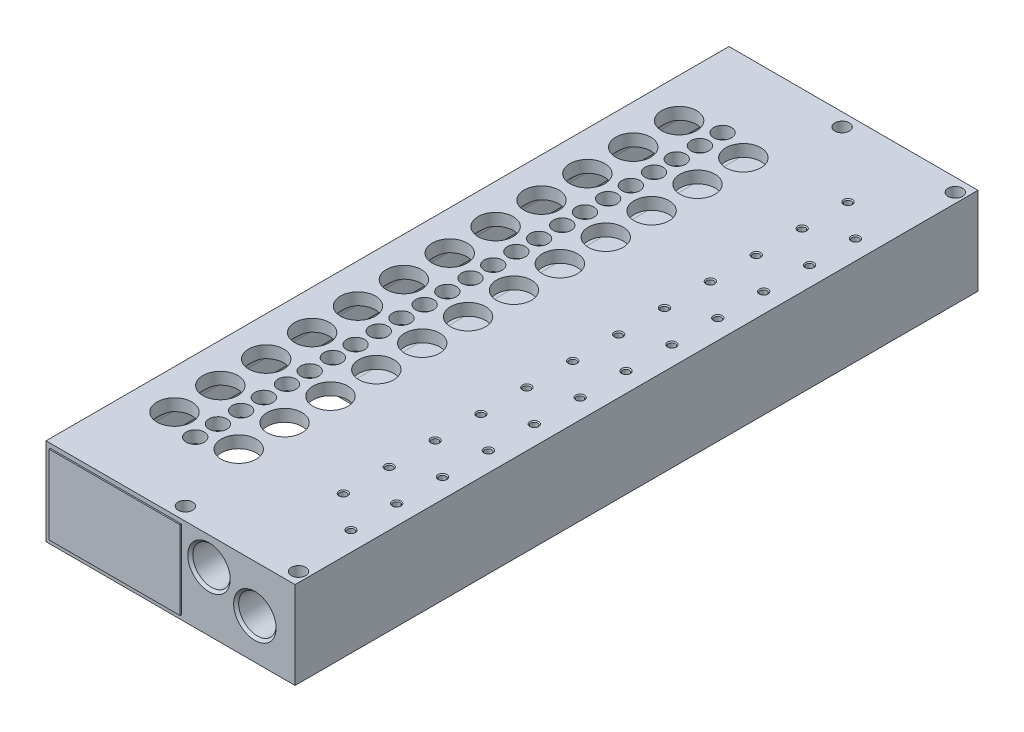
from build123d import *

# Parameters (mm, degrees)
SKETCH1_W           = 57
SKETCH1_H           = 20
BOSS_EXTRUDE1_DEPTH = 156.3
SKETCH2_R           = 4
CUT_EXTRUDE1_DEPTH  = 3
SKETCH3_R           = 4
CUT_EXTRUDE2_DEPTH  = 3
SKETCH4_R           = 4
CUT_EXTRUDE3_DEPTH  = 3
SKETCH5_R           = 4
CUT_EXTRUDE4_DEPTH  = 3
SKETCH6_R           = 4
CUT_EXTRUDE5_DEPTH  = 3
SKETCH7_R           = 4
CUT_EXTRUDE6_DEPTH  = 3
SKETCH8_R           = 4
CUT_EXTRUDE7_DEPTH  = 3
SKETCH9_R           = 4
CUT_EXTRUDE8_DEPTH  = 3
SKETCH10_R          = 4
CUT_EXTRUDE9_DEPTH  = 3
SKETCH11_R          = 4
CUT_EXTRUDE10_DEPTH = 3
SKETCH12_R          = 4
CUT_EXTRUDE11_DEPTH = 3
SKETCH13_R          = 4
CUT_EXTRUDE12_DEPTH = 3
SKETCH14_R          = 4
CUT_EXTRUDE13_DEPTH = 3
SKETCH15_R          = 4
CUT_EXTRUDE14_DEPTH = 3
SKETCH16_R          = 4
CUT_EXTRUDE15_DEPTH = 3
SKETCH17_R          = 4
CUT_EXTRUDE16_DEPTH = 3
SKETCH18_R          = 4
CUT_EXTRUDE17_DEPTH = 3
SKETCH19_R          = 4
CUT_EXTRUDE18_DEPTH = 3
SKETCH20_R          = 4
CUT_EXTRUDE19_DEPTH = 3
SKETCH21_R          = 4
CUT_EXTRUDE20_DEPTH = 3
SKETCH22_R          = 4
CUT_EXTRUDE21_DEPTH = 3
SKETCH23_R          = 4
CUT_EXTRUDE22_DEPTH = 3
SKETCH24_R          = 4
CUT_EXTRUDE23_DEPTH = 3
SKETCH25_R          = 4
CUT_EXTRUDE24_DEPTH = 3
SKETCH26_R          = 2.05
CUT_EXTRUDE25_DEPTH = 3
SKETCH27_R          = 2.05
CUT_EXTRUDE26_DEPTH = 3
SKETCH28_R          = 2.05
CUT_EXTRUDE27_DEPTH = 3
SKETCH29_R          = 2.05
CUT_EXTRUDE28_DEPTH = 3
SKETCH30_R          = 2.05
CUT_EXTRUDE29_DEPTH = 3
SKETCH31_R          = 2.05
CUT_EXTRUDE30_DEPTH = 3
SKETCH32_R          = 2.05
CUT_EXTRUDE31_DEPTH = 3
SKETCH33_R          = 2.05
CUT_EXTRUDE32_DEPTH = 3
SKETCH34_R          = 2.05
CUT_EXTRUDE33_DEPTH = 3
SKETCH35_R          = 2.05
CUT_EXTRUDE34_DEPTH = 3
SKETCH36_R          = 2.05
CUT_EXTRUDE35_DEPTH = 3
SKETCH37_R          = 2.05
CUT_EXTRUDE36_DEPTH = 3
SKETCH38_R          = 2.05
CUT_EXTRUDE37_DEPTH = 3
SKETCH39_R          = 2.05
CUT_EXTRUDE38_DEPTH = 3
SKETCH40_R          = 2.05
CUT_EXTRUDE39_DEPTH = 3
SKETCH41_R          = 2.05
CUT_EXTRUDE40_DEPTH = 3
SKETCH42_R          = 2.05
CUT_EXTRUDE41_DEPTH = 3
SKETCH43_R          = 2.05
CUT_EXTRUDE42_DEPTH = 3
SKETCH44_R          = 2.05
CUT_EXTRUDE43_DEPTH = 3
SKETCH45_R          = 2.05
CUT_EXTRUDE44_DEPTH = 3
SKETCH46_R          = 2.05
CUT_EXTRUDE45_DEPTH = 3
SKETCH47_R          = 2.05
CUT_EXTRUDE46_DEPTH = 3
SKETCH48_R          = 2.05
CUT_EXTRUDE47_DEPTH = 3
SKETCH49_R          = 2.05
CUT_EXTRUDE48_DEPTH = 3
SKETCH78_W          = 1.65
SKETCH78_H          = 20
SKETCH79_W          = 1.65
SKETCH79_H          = 20
SKETCH80_W          = 1.65
SKETCH80_H          = 20
SKETCH81_W          = 1.65
SKETCH81_H          = 20
CUT_EXTRUDE49_DEPTH = 1.4
CUT_EXTRUDE50_DEPTH = 2.9
SKETCH108_W         = 30
SKETCH108_H         = 18
BOSS_EXTRUDE2_DEPTH = 0.3
SKETCH109_W         = 30
SKETCH109_H         = 18
BOSS_EXTRUDE3_DEPTH = 0.3


with BuildPart() as part:
    # Sketch1 → Boss-Extrude1 (new body)
    with BuildSketch(Plane.XY.offset(-135.9)):
        with Locations((28.5, 10)):
            Rectangle(SKETCH1_W, SKETCH1_H)
        with BuildLine():
            Line((46.9, 7.100431067), (46.9, 8.5))
            ThreePointArc((46.9, 8.5), (47.046446609, 8.853553391), (47.4, 9))
            Line((47.4, 9), (47.85, 9))
            ThreePointArc((47.85, 9), (48.203553391, 9.146446609), (48.35, 9.5))
            Line((48.35, 9.5), (48.35, 11.396424004))
            ThreePointArc((48.35, 11.396424004), (47.872077716, 12.494311586), (46.742857143, 12.89259258))
            ThreePointArc((46.742857143, 12.89259258), (44.051066685, 9.921351181), (46.9, 7.100431067))
        make_face(mode=Mode.SUBTRACT)
        with BuildLine():
            Line((38.7, 10.80910977), (38.7, 15.19089023))
            ThreePointArc((38.7, 15.19089023), (33.9, 13), (38.7, 10.80910977))
        make_face(mode=Mode.SUBTRACT)
        with BuildLine():
            Line((2.5, 11.35), (2.5, 9.25))
            Line((2.5, 9.25), (4, 9.25))
            Line((4, 9.25), (4, 4.75))
            ThreePointArc((4, 4.75), (4.585786438, 3.335786438), (6, 2.75))
            Line((6, 2.75), (26.7, 2.75))
            ThreePointArc((26.7, 2.75), (28.114213562, 3.335786438), (28.7, 4.75))
            Line((28.7, 4.75), (28.7, 9.25))
            Line((28.7, 9.25), (30.2, 9.25))
            Line((30.2, 9.25), (30.2, 11.35))
            Line((30.2, 11.35), (28.7, 11.35))
            Line((28.7, 11.35), (28.7, 15.25))
            ThreePointArc((28.7, 15.25), (28.114213562, 16.664213562), (26.7, 17.25))
            Line((26.7, 17.25), (6, 17.25))
            ThreePointArc((6, 17.25), (4.585786438, 16.664213562), (4, 15.25))
            Line((4, 15.25), (4, 11.35))
            Line((4, 11.35), (2.5, 11.35))
        make_face(mode=Mode.SUBTRACT)
    extrude(amount=BOSS_EXTRUDE1_DEPTH)

    # Sketch2 → Cut-Extrude1 (cut)
    with BuildSketch(Plane(origin=(0, 20, 0), x_dir=(1, 0, 0), z_dir=(0, 1, 0))):
        with Locations((9, 0)):
            Circle(SKETCH2_R)
    extrude(amount=-CUT_EXTRUDE1_DEPTH, mode=Mode.SUBTRACT)

    # Sketch3 → Cut-Extrude2 (cut)
    with BuildSketch(Plane(origin=(0, 20, 0), x_dir=(1, 0, 0), z_dir=(0, 1, 0))):
        with Locations((9, 10.5)):
            Circle(SKETCH3_R)
    extrude(amount=-CUT_EXTRUDE2_DEPTH, mode=Mode.SUBTRACT)

    # Sketch4 → Cut-Extrude3 (cut)
    with BuildSketch(Plane(origin=(0, 20, 0), x_dir=(1, 0, 0), z_dir=(0, 1, 0))):
        with Locations((9, 21)):
            Circle(SKETCH4_R)
    extrude(amount=-CUT_EXTRUDE3_DEPTH, mode=Mode.SUBTRACT)

    # Sketch5 → Cut-Extrude4 (cut)
    with BuildSketch(Plane(origin=(0, 20, 0), x_dir=(1, 0, 0), z_dir=(0, 1, 0))):
        with Locations((9, 31.5)):
            Circle(SKETCH5_R)
    extrude(amount=-CUT_EXTRUDE4_DEPTH, mode=Mode.SUBTRACT)

    # Sketch6 → Cut-Extrude5 (cut)
    with BuildSketch(Plane(origin=(0, 20, 0), x_dir=(1, 0, 0), z_dir=(0, 1, 0))):
        with Locations((9, 42)):
            Circle(SKETCH6_R)
    extrude(amount=-CUT_EXTRUDE5_DEPTH, mode=Mode.SUBTRACT)

    # Sketch7 → Cut-Extrude6 (cut)
    with BuildSketch(Plane(origin=(0, 20, 0), x_dir=(1, 0, 0), z_dir=(0, 1, 0))):
        with Locations((9, 52.5)):
            Circle(SKETCH7_R)
    extrude(amount=-CUT_EXTRUDE6_DEPTH, mode=Mode.SUBTRACT)

    # Sketch8 → Cut-Extrude7 (cut)
    with BuildSketch(Plane(origin=(0, 20, 0), x_dir=(1, 0, 0), z_dir=(0, 1, 0))):
        with Locations((9, 63)):
            Circle(SKETCH8_R)
    extrude(amount=-CUT_EXTRUDE7_DEPTH, mode=Mode.SUBTRACT)

    # Sketch9 → Cut-Extrude8 (cut)
    with BuildSketch(Plane(origin=(0, 20, 0), x_dir=(1, 0, 0), z_dir=(0, 1, 0))):
        with Locations((9, 73.5)):
            Circle(SKETCH9_R)
    extrude(amount=-CUT_EXTRUDE8_DEPTH, mode=Mode.SUBTRACT)

    # Sketch10 → Cut-Extrude9 (cut)
    with BuildSketch(Plane(origin=(0, 20, 0), x_dir=(1, 0, 0), z_dir=(0, 1, 0))):
        with Locations((9, 84)):
            Circle(SKETCH10_R)
    extrude(amount=-CUT_EXTRUDE9_DEPTH, mode=Mode.SUBTRACT)

    # Sketch11 → Cut-Extrude10 (cut)
    with BuildSketch(Plane(origin=(0, 20, 0), x_dir=(1, 0, 0), z_dir=(0, 1, 0))):
        with Locations((9, 94.5)):
            Circle(SKETCH11_R)
    extrude(amount=-CUT_EXTRUDE10_DEPTH, mode=Mode.SUBTRACT)

    # Sketch12 → Cut-Extrude11 (cut)
    with BuildSketch(Plane(origin=(0, 20, 0), x_dir=(1, 0, 0), z_dir=(0, 1, 0))):
        with Locations((9, 105)):
            Circle(SKETCH12_R)
    extrude(amount=-CUT_EXTRUDE11_DEPTH, mode=Mode.SUBTRACT)

    # Sketch13 → Cut-Extrude12 (cut)
    with BuildSketch(Plane(origin=(0, 20, 0), x_dir=(1, 0, 0), z_dir=(0, 1, 0))):
        with Locations((9, 115.5)):
            Circle(SKETCH13_R)
    extrude(amount=-CUT_EXTRUDE12_DEPTH, mode=Mode.SUBTRACT)

    # Sketch14 → Cut-Extrude13 (cut)
    with BuildSketch(Plane(origin=(0, 20, 0), x_dir=(1, 0, 0), z_dir=(0, 1, 0))):
        with Locations((23.7, 0)):
            Circle(SKETCH14_R)
    extrude(amount=-CUT_EXTRUDE13_DEPTH, mode=Mode.SUBTRACT)

    # Sketch15 → Cut-Extrude14 (cut)
    with BuildSketch(Plane(origin=(0, 20, 0), x_dir=(1, 0, 0), z_dir=(0, 1, 0))):
        with Locations((23.7, 10.5)):
            Circle(SKETCH15_R)
    extrude(amount=-CUT_EXTRUDE14_DEPTH, mode=Mode.SUBTRACT)

    # Sketch16 → Cut-Extrude15 (cut)
    with BuildSketch(Plane(origin=(0, 20, 0), x_dir=(1, 0, 0), z_dir=(0, 1, 0))):
        with Locations((23.7, 21)):
            Circle(SKETCH16_R)
    extrude(amount=-CUT_EXTRUDE15_DEPTH, mode=Mode.SUBTRACT)

    # Sketch17 → Cut-Extrude16 (cut)
    with BuildSketch(Plane(origin=(0, 20, 0), x_dir=(1, 0, 0), z_dir=(0, 1, 0))):
        with Locations((23.7, 31.5)):
            Circle(SKETCH17_R)
    extrude(amount=-CUT_EXTRUDE16_DEPTH, mode=Mode.SUBTRACT)

    # Sketch18 → Cut-Extrude17 (cut)
    with BuildSketch(Plane(origin=(0, 20, 0), x_dir=(1, 0, 0), z_dir=(0, 1, 0))):
        with Locations((23.7, 42)):
            Circle(SKETCH18_R)
    extrude(amount=-CUT_EXTRUDE17_DEPTH, mode=Mode.SUBTRACT)

    # Sketch19 → Cut-Extrude18 (cut)
    with BuildSketch(Plane(origin=(0, 20, 0), x_dir=(1, 0, 0), z_dir=(0, 1, 0))):
        with Locations((23.7, 52.5)):
            Circle(SKETCH19_R)
    extrude(amount=-CUT_EXTRUDE18_DEPTH, mode=Mode.SUBTRACT)

    # Sketch20 → Cut-Extrude19 (cut)
    with BuildSketch(Plane(origin=(0, 20, 0), x_dir=(1, 0, 0), z_dir=(0, 1, 0))):
        with Locations((23.7, 63)):
            Circle(SKETCH20_R)
    extrude(amount=-CUT_EXTRUDE19_DEPTH, mode=Mode.SUBTRACT)

    # Sketch21 → Cut-Extrude20 (cut)
    with BuildSketch(Plane(origin=(0, 20, 0), x_dir=(1, 0, 0), z_dir=(0, 1, 0))):
        with Locations((23.7, 73.5)):
            Circle(SKETCH21_R)
    extrude(amount=-CUT_EXTRUDE20_DEPTH, mode=Mode.SUBTRACT)

    # Sketch22 → Cut-Extrude21 (cut)
    with BuildSketch(Plane(origin=(0, 20, 0), x_dir=(1, 0, 0), z_dir=(0, 1, 0))):
        with Locations((23.7, 84)):
            Circle(SKETCH22_R)
    extrude(amount=-CUT_EXTRUDE21_DEPTH, mode=Mode.SUBTRACT)

    # Sketch23 → Cut-Extrude22 (cut)
    with BuildSketch(Plane(origin=(0, 20, 0), x_dir=(1, 0, 0), z_dir=(0, 1, 0))):
        with Locations((23.7, 94.5)):
            Circle(SKETCH23_R)
    extrude(amount=-CUT_EXTRUDE22_DEPTH, mode=Mode.SUBTRACT)

    # Sketch24 → Cut-Extrude23 (cut)
    with BuildSketch(Plane(origin=(0, 20, 0), x_dir=(1, 0, 0), z_dir=(0, 1, 0))):
        with Locations((23.7, 105)):
            Circle(SKETCH24_R)
    extrude(amount=-CUT_EXTRUDE23_DEPTH, mode=Mode.SUBTRACT)

    # Sketch25 → Cut-Extrude24 (cut)
    with BuildSketch(Plane(origin=(0, 20, 0), x_dir=(1, 0, 0), z_dir=(0, 1, 0))):
        with Locations((23.7, 115.5)):
            Circle(SKETCH25_R)
    extrude(amount=-CUT_EXTRUDE24_DEPTH, mode=Mode.SUBTRACT)

    # Sketch26 → Cut-Extrude25 (cut)
    with BuildSketch(Plane(origin=(0, 20, 0), x_dir=(1, 0, 0), z_dir=(0, 1, 0))):
        with Locations((16.35, -2.6)):
            Circle(SKETCH26_R)
    extrude(amount=-CUT_EXTRUDE25_DEPTH, mode=Mode.SUBTRACT)

    # Sketch27 → Cut-Extrude26 (cut)
    with BuildSketch(Plane(origin=(0, 20, 0), x_dir=(1, 0, 0), z_dir=(0, 1, 0))):
        with Locations((16.35, 7.9)):
            Circle(SKETCH27_R)
    extrude(amount=-CUT_EXTRUDE26_DEPTH, mode=Mode.SUBTRACT)

    # Sketch28 → Cut-Extrude27 (cut)
    with BuildSketch(Plane(origin=(0, 20, 0), x_dir=(1, 0, 0), z_dir=(0, 1, 0))):
        with Locations((16.35, 18.4)):
            Circle(SKETCH28_R)
    extrude(amount=-CUT_EXTRUDE27_DEPTH, mode=Mode.SUBTRACT)

    # Sketch29 → Cut-Extrude28 (cut)
    with BuildSketch(Plane(origin=(0, 20, 0), x_dir=(1, 0, 0), z_dir=(0, 1, 0))):
        with Locations((16.35, 28.9)):
            Circle(SKETCH29_R)
    extrude(amount=-CUT_EXTRUDE28_DEPTH, mode=Mode.SUBTRACT)

    # Sketch30 → Cut-Extrude29 (cut)
    with BuildSketch(Plane(origin=(0, 20, 0), x_dir=(1, 0, 0), z_dir=(0, 1, 0))):
        with Locations((16.35, 39.4)):
            Circle(SKETCH30_R)
    extrude(amount=-CUT_EXTRUDE29_DEPTH, mode=Mode.SUBTRACT)

    # Sketch31 → Cut-Extrude30 (cut)
    with BuildSketch(Plane(origin=(0, 20, 0), x_dir=(1, 0, 0), z_dir=(0, 1, 0))):
        with Locations((16.35, 49.9)):
            Circle(SKETCH31_R)
    extrude(amount=-CUT_EXTRUDE30_DEPTH, mode=Mode.SUBTRACT)

    # Sketch32 → Cut-Extrude31 (cut)
    with BuildSketch(Plane(origin=(0, 20, 0), x_dir=(1, 0, 0), z_dir=(0, 1, 0))):
        with Locations((16.35, 60.4)):
            Circle(SKETCH32_R)
    extrude(amount=-CUT_EXTRUDE31_DEPTH, mode=Mode.SUBTRACT)

    # Sketch33 → Cut-Extrude32 (cut)
    with BuildSketch(Plane(origin=(0, 20, 0), x_dir=(1, 0, 0), z_dir=(0, 1, 0))):
        with Locations((16.35, 70.9)):
            Circle(SKETCH33_R)
    extrude(amount=-CUT_EXTRUDE32_DEPTH, mode=Mode.SUBTRACT)

    # Sketch34 → Cut-Extrude33 (cut)
    with BuildSketch(Plane(origin=(0, 20, 0), x_dir=(1, 0, 0), z_dir=(0, 1, 0))):
        with Locations((16.35, 81.4)):
            Circle(SKETCH34_R)
    extrude(amount=-CUT_EXTRUDE33_DEPTH, mode=Mode.SUBTRACT)

    # Sketch35 → Cut-Extrude34 (cut)
    with BuildSketch(Plane(origin=(0, 20, 0), x_dir=(1, 0, 0), z_dir=(0, 1, 0))):
        with Locations((16.35, 91.9)):
            Circle(SKETCH35_R)
    extrude(amount=-CUT_EXTRUDE34_DEPTH, mode=Mode.SUBTRACT)

    # Sketch36 → Cut-Extrude35 (cut)
    with BuildSketch(Plane(origin=(0, 20, 0), x_dir=(1, 0, 0), z_dir=(0, 1, 0))):
        with Locations((16.35, 102.4)):
            Circle(SKETCH36_R)
    extrude(amount=-CUT_EXTRUDE35_DEPTH, mode=Mode.SUBTRACT)

    # Sketch37 → Cut-Extrude36 (cut)
    with BuildSketch(Plane(origin=(0, 20, 0), x_dir=(1, 0, 0), z_dir=(0, 1, 0))):
        with Locations((16.35, 112.9)):
            Circle(SKETCH37_R)
    extrude(amount=-CUT_EXTRUDE36_DEPTH, mode=Mode.SUBTRACT)

    # Sketch38 → Cut-Extrude37 (cut)
    with BuildSketch(Plane(origin=(0, 20, 0), x_dir=(1, 0, 0), z_dir=(0, 1, 0))):
        with Locations((16.35, 2.6)):
            Circle(SKETCH38_R)
    extrude(amount=-CUT_EXTRUDE37_DEPTH, mode=Mode.SUBTRACT)

    # Sketch39 → Cut-Extrude38 (cut)
    with BuildSketch(Plane(origin=(0, 20, 0), x_dir=(1, 0, 0), z_dir=(0, 1, 0))):
        with Locations((16.35, 13.1)):
            Circle(SKETCH39_R)
    extrude(amount=-CUT_EXTRUDE38_DEPTH, mode=Mode.SUBTRACT)

    # Sketch40 → Cut-Extrude39 (cut)
    with BuildSketch(Plane(origin=(0, 20, 0), x_dir=(1, 0, 0), z_dir=(0, 1, 0))):
        with Locations((16.35, 23.6)):
            Circle(SKETCH40_R)
    extrude(amount=-CUT_EXTRUDE39_DEPTH, mode=Mode.SUBTRACT)

    # Sketch41 → Cut-Extrude40 (cut)
    with BuildSketch(Plane(origin=(0, 20, 0), x_dir=(1, 0, 0), z_dir=(0, 1, 0))):
        with Locations((16.35, 34.1)):
            Circle(SKETCH41_R)
    extrude(amount=-CUT_EXTRUDE40_DEPTH, mode=Mode.SUBTRACT)

    # Sketch42 → Cut-Extrude41 (cut)
    with BuildSketch(Plane(origin=(0, 20, 0), x_dir=(1, 0, 0), z_dir=(0, 1, 0))):
        with Locations((16.35, 44.6)):
            Circle(SKETCH42_R)
    extrude(amount=-CUT_EXTRUDE41_DEPTH, mode=Mode.SUBTRACT)

    # Sketch43 → Cut-Extrude42 (cut)
    with BuildSketch(Plane(origin=(0, 20, 0), x_dir=(1, 0, 0), z_dir=(0, 1, 0))):
        with Locations((16.35, 55.1)):
            Circle(SKETCH43_R)
    extrude(amount=-CUT_EXTRUDE42_DEPTH, mode=Mode.SUBTRACT)

    # Sketch44 → Cut-Extrude43 (cut)
    with BuildSketch(Plane(origin=(0, 20, 0), x_dir=(1, 0, 0), z_dir=(0, 1, 0))):
        with Locations((16.35, 65.6)):
            Circle(SKETCH44_R)
    extrude(amount=-CUT_EXTRUDE43_DEPTH, mode=Mode.SUBTRACT)

    # Sketch45 → Cut-Extrude44 (cut)
    with BuildSketch(Plane(origin=(0, 20, 0), x_dir=(1, 0, 0), z_dir=(0, 1, 0))):
        with Locations((16.35, 76.1)):
            Circle(SKETCH45_R)
    extrude(amount=-CUT_EXTRUDE44_DEPTH, mode=Mode.SUBTRACT)

    # Sketch46 → Cut-Extrude45 (cut)
    with BuildSketch(Plane(origin=(0, 20, 0), x_dir=(1, 0, 0), z_dir=(0, 1, 0))):
        with Locations((16.35, 86.6)):
            Circle(SKETCH46_R)
    extrude(amount=-CUT_EXTRUDE45_DEPTH, mode=Mode.SUBTRACT)

    # Sketch47 → Cut-Extrude46 (cut)
    with BuildSketch(Plane(origin=(0, 20, 0), x_dir=(1, 0, 0), z_dir=(0, 1, 0))):
        with Locations((16.35, 97.1)):
            Circle(SKETCH47_R)
    extrude(amount=-CUT_EXTRUDE46_DEPTH, mode=Mode.SUBTRACT)

    # Sketch48 → Cut-Extrude47 (cut)
    with BuildSketch(Plane(origin=(0, 20, 0), x_dir=(1, 0, 0), z_dir=(0, 1, 0))):
        with Locations((16.35, 107.6)):
            Circle(SKETCH48_R)
    extrude(amount=-CUT_EXTRUDE47_DEPTH, mode=Mode.SUBTRACT)

    # Sketch49 → Cut-Extrude48 (cut)
    with BuildSketch(Plane(origin=(0, 20, 0), x_dir=(1, 0, 0), z_dir=(0, 1, 0))):
        with Locations((16.35, 118.1)):
            Circle(SKETCH49_R)
    extrude(amount=-CUT_EXTRUDE48_DEPTH, mode=Mode.SUBTRACT)

    # Sketch50 → Cut-Revolve1 (revolve, cut)
    with BuildSketch(Plane(origin=(44.45, 0, 0), x_dir=(0, 0, -1), z_dir=(1, 0, 0))):
        Polygon((3.2, 20), (4.2, 20), (3.9835, 19.7835), (3.9835, 14.452353936), (3.2, 14), align=None)
    revolve(axis=Axis((44.45, 14, -3.2), (0, 1, 0)), mode=Mode.SUBTRACT)

    # Sketch51 → Cut-Revolve2 (revolve, cut)
    with BuildSketch(Plane(origin=(44.45, 0, 0), x_dir=(0, 0, -1), z_dir=(1, 0, 0))):
        Polygon((13.7, 20), (14.7, 20), (14.4835, 19.7835), (14.4835, 14.452353936), (13.7, 14), align=None)
    revolve(axis=Axis((44.45, 14, -13.7), (0, 1, 0)), mode=Mode.SUBTRACT)

    # Sketch52 → Cut-Revolve3 (revolve, cut)
    with BuildSketch(Plane(origin=(44.45, 0, 0), x_dir=(0, 0, -1), z_dir=(1, 0, 0))):
        Polygon((24.2, 20), (25.2, 20), (24.9835, 19.7835), (24.9835, 14.452353936), (24.2, 14), align=None)
    revolve(axis=Axis((44.45, 14, -24.2), (0, 1, 0)), mode=Mode.SUBTRACT)

    # Sketch53 → Cut-Revolve4 (revolve, cut)
    with BuildSketch(Plane(origin=(44.45, 0, 0), x_dir=(0, 0, -1), z_dir=(1, 0, 0))):
        Polygon((34.7, 20), (35.7, 20), (35.4835, 19.7835), (35.4835, 14.452353936), (34.7, 14), align=None)
    revolve(axis=Axis((44.45, 14, -34.7), (0, 1, 0)), mode=Mode.SUBTRACT)

    # Sketch54 → Cut-Revolve5 (revolve, cut)
    with BuildSketch(Plane(origin=(44.45, 0, 0), x_dir=(0, 0, -1), z_dir=(1, 0, 0))):
        Polygon((45.2, 20), (46.2, 20), (45.9835, 19.7835), (45.9835, 14.452353936), (45.2, 14), align=None)
    revolve(axis=Axis((44.45, 14, -45.2), (0, 1, 0)), mode=Mode.SUBTRACT)

    # Sketch55 → Cut-Revolve6 (revolve, cut)
    with BuildSketch(Plane(origin=(44.45, 0, 0), x_dir=(0, 0, -1), z_dir=(1, 0, 0))):
        Polygon((55.7, 20), (56.7, 20), (56.4835, 19.7835), (56.4835, 14.452353936), (55.7, 14), align=None)
    revolve(axis=Axis((44.45, 14, -55.7), (0, 1, 0)), mode=Mode.SUBTRACT)

    # Sketch56 → Cut-Revolve7 (revolve, cut)
    with BuildSketch(Plane(origin=(44.45, 0, 0), x_dir=(0, 0, -1), z_dir=(1, 0, 0))):
        Polygon((66.2, 20), (67.2, 20), (66.9835, 19.7835), (66.9835, 14.452353936), (66.2, 14), align=None)
    revolve(axis=Axis((44.45, 14, -66.2), (0, 1, 0)), mode=Mode.SUBTRACT)

    # Sketch57 → Cut-Revolve8 (revolve, cut)
    with BuildSketch(Plane(origin=(44.45, 0, 0), x_dir=(0, 0, -1), z_dir=(1, 0, 0))):
        Polygon((76.7, 20), (77.7, 20), (77.4835, 19.7835), (77.4835, 14.452353936), (76.7, 14), align=None)
    revolve(axis=Axis((44.45, 14, -76.7), (0, 1, 0)), mode=Mode.SUBTRACT)

    # Sketch58 → Cut-Revolve9 (revolve, cut)
    with BuildSketch(Plane(origin=(44.45, 0, 0), x_dir=(0, 0, -1), z_dir=(1, 0, 0))):
        Polygon((87.2, 20), (88.2, 20), (87.9835, 19.7835), (87.9835, 14.452353936), (87.2, 14), align=None)
    revolve(axis=Axis((44.45, 14, -87.2), (0, 1, 0)), mode=Mode.SUBTRACT)

    # Sketch59 → Cut-Revolve10 (revolve, cut)
    with BuildSketch(Plane(origin=(44.45, 0, 0), x_dir=(0, 0, -1), z_dir=(1, 0, 0))):
        Polygon((97.7, 20), (98.7, 20), (98.4835, 19.7835), (98.4835, 14.452353936), (97.7, 14), align=None)
    revolve(axis=Axis((44.45, 14, -97.7), (0, 1, 0)), mode=Mode.SUBTRACT)

    # Sketch60 → Cut-Revolve11 (revolve, cut)
    with BuildSketch(Plane(origin=(44.45, 0, 0), x_dir=(0, 0, -1), z_dir=(1, 0, 0))):
        Polygon((108.2, 20), (109.2, 20), (108.9835, 19.7835), (108.9835, 14.452353936), (108.2, 14), align=None)
    revolve(axis=Axis((44.45, 14, -108.2), (0, 1, 0)), mode=Mode.SUBTRACT)

    # Sketch61 → Cut-Revolve12 (revolve, cut)
    with BuildSketch(Plane(origin=(44.45, 0, 0), x_dir=(0, 0, -1), z_dir=(1, 0, 0))):
        Polygon((118.7, 20), (119.7, 20), (119.4835, 19.7835), (119.4835, 14.452353936), (118.7, 14), align=None)
    revolve(axis=Axis((44.45, 14, -118.7), (0, 1, 0)), mode=Mode.SUBTRACT)

    # Sketch62 → Cut-Revolve13 (revolve, cut)
    with BuildSketch(Plane(origin=(52.6, 0, 0), x_dir=(0, 0, -1), z_dir=(1, 0, 0))):
        Polygon((-3.2, 20), (-2.2, 20), (-2.4165, 19.7835), (-2.4165, 14.452353936), (-3.2, 14), align=None)
    revolve(axis=Axis((52.6, 14, 3.2), (0, 1, 0)), mode=Mode.SUBTRACT)

    # Sketch63 → Cut-Revolve14 (revolve, cut)
    with BuildSketch(Plane(origin=(52.55, 0, 0), x_dir=(0, 0, -1), z_dir=(1, 0, 0))):
        Polygon((7.3, 20), (8.3, 20), (8.0835, 19.7835), (8.0835, 14.452353936), (7.3, 14), align=None)
    revolve(axis=Axis((52.55, 14, -7.3), (0, 1, 0)), mode=Mode.SUBTRACT)

    # Sketch64 → Cut-Revolve15 (revolve, cut)
    with BuildSketch(Plane(origin=(52.55, 0, 0), x_dir=(0, 0, -1), z_dir=(1, 0, 0))):
        Polygon((17.8, 20), (18.8, 20), (18.5835, 19.7835), (18.5835, 14.452353936), (17.8, 14), align=None)
    revolve(axis=Axis((52.55, 14, -17.8), (0, 1, 0)), mode=Mode.SUBTRACT)

    # Sketch65 → Cut-Revolve16 (revolve, cut)
    with BuildSketch(Plane(origin=(52.55, 0, 0), x_dir=(0, 0, -1), z_dir=(1, 0, 0))):
        Polygon((28.3, 20), (29.3, 20), (29.0835, 19.7835), (29.0835, 14.452353936), (28.3, 14), align=None)
    revolve(axis=Axis((52.55, 14, -28.3), (0, 1, 0)), mode=Mode.SUBTRACT)

    # Sketch66 → Cut-Revolve17 (revolve, cut)
    with BuildSketch(Plane(origin=(52.55, 0, 0), x_dir=(0, 0, -1), z_dir=(1, 0, 0))):
        Polygon((38.8, 20), (39.8, 20), (39.5835, 19.7835), (39.5835, 14.452353936), (38.8, 14), align=None)
    revolve(axis=Axis((52.55, 14, -38.8), (0, 1, 0)), mode=Mode.SUBTRACT)

    # Sketch67 → Cut-Revolve18 (revolve, cut)
    with BuildSketch(Plane(origin=(52.55, 0, 0), x_dir=(0, 0, -1), z_dir=(1, 0, 0))):
        Polygon((49.3, 20), (50.3, 20), (50.0835, 19.7835), (50.0835, 14.452353936), (49.3, 14), align=None)
    revolve(axis=Axis((52.55, 14, -49.3), (0, 1, 0)), mode=Mode.SUBTRACT)

    # Sketch68 → Cut-Revolve19 (revolve, cut)
    with BuildSketch(Plane(origin=(52.55, 0, 0), x_dir=(0, 0, -1), z_dir=(1, 0, 0))):
        Polygon((59.8, 20), (60.8, 20), (60.5835, 19.7835), (60.5835, 14.452353936), (59.8, 14), align=None)
    revolve(axis=Axis((52.55, 14, -59.8), (0, 1, 0)), mode=Mode.SUBTRACT)

    # Sketch69 → Cut-Revolve20 (revolve, cut)
    with BuildSketch(Plane(origin=(52.55, 0, 0), x_dir=(0, 0, -1), z_dir=(1, 0, 0))):
        Polygon((70.3, 20), (71.3, 20), (71.0835, 19.7835), (71.0835, 14.452353936), (70.3, 14), align=None)
    revolve(axis=Axis((52.55, 14, -70.3), (0, 1, 0)), mode=Mode.SUBTRACT)

    # Sketch70 → Cut-Revolve21 (revolve, cut)
    with BuildSketch(Plane(origin=(52.55, 0, 0), x_dir=(0, 0, -1), z_dir=(1, 0, 0))):
        Polygon((80.8, 20), (81.8, 20), (81.5835, 19.7835), (81.5835, 14.452353936), (80.8, 14), align=None)
    revolve(axis=Axis((52.55, 14, -80.8), (0, 1, 0)), mode=Mode.SUBTRACT)

    # Sketch71 → Cut-Revolve22 (revolve, cut)
    with BuildSketch(Plane(origin=(52.55, 0, 0), x_dir=(0, 0, -1), z_dir=(1, 0, 0))):
        Polygon((91.3, 20), (92.3, 20), (92.0835, 19.7835), (92.0835, 14.452353936), (91.3, 14), align=None)
    revolve(axis=Axis((52.55, 14, -91.3), (0, 1, 0)), mode=Mode.SUBTRACT)

    # Sketch72 → Cut-Revolve23 (revolve, cut)
    with BuildSketch(Plane(origin=(52.55, 0, 0), x_dir=(0, 0, -1), z_dir=(1, 0, 0))):
        Polygon((101.8, 20), (102.8, 20), (102.5835, 19.7835), (102.5835, 14.452353936), (101.8, 14), align=None)
    revolve(axis=Axis((52.55, 14, -101.8), (0, 1, 0)), mode=Mode.SUBTRACT)

    # Sketch73 → Cut-Revolve24 (revolve, cut)
    with BuildSketch(Plane(origin=(52.55, 0, 0), x_dir=(0, 0, -1), z_dir=(1, 0, 0))):
        Polygon((112.3, 20), (113.3, 20), (113.0835, 19.7835), (113.0835, 14.452353936), (112.3, 14), align=None)
    revolve(axis=Axis((52.55, 14, -112.3), (0, 1, 0)), mode=Mode.SUBTRACT)

    # Sketch74 → Cut-Revolve25 (revolve, cut)
    with BuildSketch(Plane(origin=(37.3, 0, 0), x_dir=(0, 0, -1), z_dir=(1, 0, 0))):
        Polygon((-20.4, 13.6), (-20.4, 18.464), (-19.819, 17.883), (-9.4, 17.883), (-9.4, 13.6), align=None)
    revolve(axis=Axis((37.3, 13.6, 9.4), (0, 0, 1)), mode=Mode.SUBTRACT)

    # Sketch75 → Cut-Revolve26 (revolve, cut)
    with BuildSketch(Plane(origin=(37.3, 0, 0), x_dir=(0, 0, -1), z_dir=(1, 0, 0))):
        Polygon((124.9, 13.6), (124.9, 17.883), (135.319, 17.883), (135.9, 18.464), (135.9, 13.6), align=None)
    revolve(axis=Axis((37.3, 13.6, -135.9), (0, 0, 1)), mode=Mode.SUBTRACT)

    # Sketch76 → Cut-Revolve27 (revolve, cut)
    with BuildSketch(Plane(origin=(47.8, 0, 0), x_dir=(0, 0, -1), z_dir=(1, 0, 0))):
        Polygon((-20.4, 9.2), (-20.4, 14.064), (-19.819, 13.483), (-9.4, 13.483), (-9.4, 9.2), align=None)
    revolve(axis=Axis((47.8, 9.2, 9.4), (0, 0, 1)), mode=Mode.SUBTRACT)

    # Sketch77 → Cut-Revolve28 (revolve, cut)
    with BuildSketch(Plane(origin=(47.8, 0, 0), x_dir=(0, 0, -1), z_dir=(1, 0, 0))):
        Polygon((124.9, 9.2), (124.9, 13.483), (135.319, 13.483), (135.9, 14.064), (135.9, 9.2), align=None)
    revolve(axis=Axis((47.8, 9.2, -135.9), (0, 0, 1)), mode=Mode.SUBTRACT)

    # Sketch78 → Cut-Revolve29 (revolve, cut)
    with BuildSketch(Plane.XY.offset(17.4)):
        with Locations((55.625, 10)):
            Rectangle(SKETCH78_W, SKETCH78_H)
    revolve(axis=Axis((54.8, 0, 17.4), (0, 1, 0)), mode=Mode.SUBTRACT)

    # Sketch79 → Cut-Revolve30 (revolve, cut)
    with BuildSketch(Plane.XY.offset(17.4)):
        with Locations((29.725, 10)):
            Rectangle(SKETCH79_W, SKETCH79_H)
    revolve(axis=Axis((28.9, 0, 17.4), (0, 1, 0)), mode=Mode.SUBTRACT)

    # Sketch80 → Cut-Revolve31 (revolve, cut)
    with BuildSketch(Plane.XY.offset(-132.9)):
        with Locations((55.625, 10)):
            Rectangle(SKETCH80_W, SKETCH80_H)
    revolve(axis=Axis((54.8, 0, -132.9), (0, 1, 0)), mode=Mode.SUBTRACT)

    # Sketch81 → Cut-Revolve32 (revolve, cut)
    with BuildSketch(Plane.XY.offset(-132.9)):
        with Locations((29.725, 10)):
            Rectangle(SKETCH81_W, SKETCH81_H)
    revolve(axis=Axis((28.9, 0, -132.9), (0, 1, 0)), mode=Mode.SUBTRACT)

    # Sketch82 → Cut-Revolve33 (revolve, cut)
    with BuildSketch(Plane.XY.offset(2.5)):
        Polygon((40.4, 7.2), (42.467, 7.2), (42.467, 0.433), (42.9, 0), (40.4, 0), align=None)
    revolve(axis=Axis((40.4, 0, 2.5), (0, 1, 0)), mode=Mode.SUBTRACT)

    # Sketch83 → Cut-Revolve34 (revolve, cut)
    with BuildSketch(Plane.XY.offset(-8)):
        Polygon((40.4, 7.2), (42.467, 7.2), (42.467, 0.433), (42.9, 0), (40.4, 0), align=None)
    revolve(axis=Axis((40.4, 0, -8), (0, 1, 0)), mode=Mode.SUBTRACT)

    # Sketch84 → Cut-Revolve35 (revolve, cut)
    with BuildSketch(Plane.XY.offset(-18.5)):
        Polygon((40.4, 7.2), (42.467, 7.2), (42.467, 0.433), (42.9, 0), (40.4, 0), align=None)
    revolve(axis=Axis((40.4, 0, -18.5), (0, 1, 0)), mode=Mode.SUBTRACT)

    # Sketch85 → Cut-Revolve36 (revolve, cut)
    with BuildSketch(Plane.XY.offset(-29)):
        Polygon((40.4, 7.2), (42.467, 7.2), (42.467, 0.433), (42.9, 0), (40.4, 0), align=None)
    revolve(axis=Axis((40.4, 0, -29), (0, 1, 0)), mode=Mode.SUBTRACT)

    # Sketch86 → Cut-Revolve37 (revolve, cut)
    with BuildSketch(Plane.XY.offset(-39.5)):
        Polygon((40.4, 7.2), (42.467, 7.2), (42.467, 0.433), (42.9, 0), (40.4, 0), align=None)
    revolve(axis=Axis((40.4, 0, -39.5), (0, 1, 0)), mode=Mode.SUBTRACT)

    # Sketch87 → Cut-Revolve38 (revolve, cut)
    with BuildSketch(Plane.XY.offset(-50)):
        Polygon((40.4, 7.2), (42.467, 7.2), (42.467, 0.433), (42.9, 0), (40.4, 0), align=None)
    revolve(axis=Axis((40.4, 0, -50), (0, 1, 0)), mode=Mode.SUBTRACT)

    # Sketch88 → Cut-Revolve39 (revolve, cut)
    with BuildSketch(Plane.XY.offset(-60.5)):
        Polygon((40.4, 7.2), (42.467, 7.2), (42.467, 0.433), (42.9, 0), (40.4, 0), align=None)
    revolve(axis=Axis((40.4, 0, -60.5), (0, 1, 0)), mode=Mode.SUBTRACT)

    # Sketch89 → Cut-Revolve40 (revolve, cut)
    with BuildSketch(Plane.XY.offset(-71)):
        Polygon((40.4, 7.2), (42.467, 7.2), (42.467, 0.433), (42.9, 0), (40.4, 0), align=None)
    revolve(axis=Axis((40.4, 0, -71), (0, 1, 0)), mode=Mode.SUBTRACT)

    # Sketch90 → Cut-Revolve41 (revolve, cut)
    with BuildSketch(Plane.XY.offset(-81.5)):
        Polygon((40.4, 7.2), (42.467, 7.2), (42.467, 0.433), (42.9, 0), (40.4, 0), align=None)
    revolve(axis=Axis((40.4, 0, -81.5), (0, 1, 0)), mode=Mode.SUBTRACT)

    # Sketch91 → Cut-Revolve42 (revolve, cut)
    with BuildSketch(Plane.XY.offset(-92)):
        Polygon((40.4, 7.2), (42.467, 7.2), (42.467, 0.433), (42.9, 0), (40.4, 0), align=None)
    revolve(axis=Axis((40.4, 0, -92), (0, 1, 0)), mode=Mode.SUBTRACT)

    # Sketch92 → Cut-Revolve43 (revolve, cut)
    with BuildSketch(Plane.XY.offset(-102.5)):
        Polygon((40.4, 7.2), (42.467, 7.2), (42.467, 0.433), (42.9, 0), (40.4, 0), align=None)
    revolve(axis=Axis((40.4, 0, -102.5), (0, 1, 0)), mode=Mode.SUBTRACT)

    # Sketch93 → Cut-Revolve44 (revolve, cut)
    with BuildSketch(Plane.XY.offset(-113)):
        Polygon((40.4, 7.2), (42.467, 7.2), (42.467, 0.433), (42.9, 0), (40.4, 0), align=None)
    revolve(axis=Axis((40.4, 0, -113), (0, 1, 0)), mode=Mode.SUBTRACT)

    # Sketch94 → Cut-Revolve45 (revolve, cut)
    with BuildSketch(Plane.XY.offset(-2.4)):
        Polygon((49.3, 7.2), (51.367, 7.2), (51.367, 0.433), (51.8, 0), (49.3, 0), align=None)
    revolve(axis=Axis((49.3, 0, -2.4), (0, 1, 0)), mode=Mode.SUBTRACT)

    # Sketch95 → Cut-Revolve46 (revolve, cut)
    with BuildSketch(Plane.XY.offset(-12.9)):
        Polygon((49.3, 7.2), (51.367, 7.2), (51.367, 0.433), (51.8, 0), (49.3, 0), align=None)
    revolve(axis=Axis((49.3, 0, -12.9), (0, 1, 0)), mode=Mode.SUBTRACT)

    # Sketch96 → Cut-Revolve47 (revolve, cut)
    with BuildSketch(Plane.XY.offset(-23.4)):
        Polygon((49.3, 7.2), (51.367, 7.2), (51.367, 0.433), (51.8, 0), (49.3, 0), align=None)
    revolve(axis=Axis((49.3, 0, -23.4), (0, 1, 0)), mode=Mode.SUBTRACT)

    # Sketch97 → Cut-Revolve48 (revolve, cut)
    with BuildSketch(Plane.XY.offset(-33.9)):
        Polygon((49.3, 7.2), (51.367, 7.2), (51.367, 0.433), (51.8, 0), (49.3, 0), align=None)
    revolve(axis=Axis((49.3, 0, -33.9), (0, 1, 0)), mode=Mode.SUBTRACT)

    # Sketch98 → Cut-Revolve49 (revolve, cut)
    with BuildSketch(Plane.XY.offset(-44.4)):
        Polygon((49.3, 7.2), (51.367, 7.2), (51.367, 0.433), (51.8, 0), (49.3, 0), align=None)
    revolve(axis=Axis((49.3, 0, -44.4), (0, 1, 0)), mode=Mode.SUBTRACT)

    # Sketch99 → Cut-Revolve50 (revolve, cut)
    with BuildSketch(Plane.XY.offset(-54.9)):
        Polygon((49.3, 7.2), (51.367, 7.2), (51.367, 0.433), (51.8, 0), (49.3, 0), align=None)
    revolve(axis=Axis((49.3, 0, -54.9), (0, 1, 0)), mode=Mode.SUBTRACT)

    # Sketch100 → Cut-Revolve51 (revolve, cut)
    with BuildSketch(Plane.XY.offset(-65.4)):
        Polygon((49.3, 7.2), (51.367, 7.2), (51.367, 0.433), (51.8, 0), (49.3, 0), align=None)
    revolve(axis=Axis((49.3, 0, -65.4), (0, 1, 0)), mode=Mode.SUBTRACT)

    # Sketch101 → Cut-Revolve52 (revolve, cut)
    with BuildSketch(Plane.XY.offset(-75.9)):
        Polygon((49.3, 7.2), (51.367, 7.2), (51.367, 0.433), (51.8, 0), (49.3, 0), align=None)
    revolve(axis=Axis((49.3, 0, -75.9), (0, 1, 0)), mode=Mode.SUBTRACT)

    # Sketch102 → Cut-Revolve53 (revolve, cut)
    with BuildSketch(Plane.XY.offset(-86.4)):
        Polygon((49.3, 7.2), (51.367, 7.2), (51.367, 0.433), (51.8, 0), (49.3, 0), align=None)
    revolve(axis=Axis((49.3, 0, -86.4), (0, 1, 0)), mode=Mode.SUBTRACT)

    # Sketch103 → Cut-Revolve54 (revolve, cut)
    with BuildSketch(Plane.XY.offset(-96.9)):
        Polygon((49.3, 7.2), (51.367, 7.2), (51.367, 0.433), (51.8, 0), (49.3, 0), align=None)
    revolve(axis=Axis((49.3, 0, -96.9), (0, 1, 0)), mode=Mode.SUBTRACT)

    # Sketch104 → Cut-Revolve55 (revolve, cut)
    with BuildSketch(Plane.XY.offset(-107.4)):
        Polygon((49.3, 7.2), (51.367, 7.2), (51.367, 0.433), (51.8, 0), (49.3, 0), align=None)
    revolve(axis=Axis((49.3, 0, -107.4), (0, 1, 0)), mode=Mode.SUBTRACT)

    # Sketch105 → Cut-Revolve56 (revolve, cut)
    with BuildSketch(Plane.XY.offset(-117.9)):
        Polygon((49.3, 7.2), (51.367, 7.2), (51.367, 0.433), (51.8, 0), (49.3, 0), align=None)
    revolve(axis=Axis((49.3, 0, -117.9), (0, 1, 0)), mode=Mode.SUBTRACT)

    # Sketch106 → Cut-Extrude49 (cut)
    with BuildSketch(Plane(origin=(0, 0, 0), x_dir=(1, 0, 0), z_dir=(0, 1, 0))):
        with BuildLine():
            Line((0, 44.9), (0, -13.4))
            Line((0, -13.4), (30.95, -13.4))
            ThreePointArc((30.95, -13.4), (32.717766953, -12.667766953), (33.45, -10.9))
            Line((33.45, -10.9), (33.45, 42.4))
            ThreePointArc((33.45, 42.4), (32.717766953, 44.167766953), (30.95, 44.9))
            Line((30.95, 44.9), (0, 44.9))
        make_face()
    extrude(amount=CUT_EXTRUDE49_DEPTH, mode=Mode.SUBTRACT)

    # Sketch107 → Cut-Extrude50 (cut)
    with BuildSketch(Plane(origin=(0, 0, 0), x_dir=(1, 0, 0), z_dir=(0, 1, 0))):
        with BuildLine():
            Line((0, 40.4), (0, -8.9))
            Line((0, -8.9), (30.95, -8.9))
            ThreePointArc((30.95, -8.9), (32.717766953, -8.167766953), (33.45, -6.4))
            Line((33.45, -6.4), (33.45, 37.9))
            ThreePointArc((33.45, 37.9), (32.717766953, 39.667766953), (30.95, 40.4))
            Line((30.95, 40.4), (0, 40.4))
        make_face()
    extrude(amount=CUT_EXTRUDE50_DEPTH, mode=Mode.SUBTRACT)

    # Sketch108 → Boss-Extrude2 (add)
    with BuildSketch(Plane.XY.offset(20.4)):
        with Locations((16, 10)):
            Rectangle(SKETCH108_W, SKETCH108_H)
    extrude(amount=BOSS_EXTRUDE2_DEPTH)

    # Sketch109 → Boss-Extrude3 (add)
    with BuildSketch(Plane.XY.offset(-135.9)):
        with Locations((16, 10)):
            Rectangle(SKETCH109_W, SKETCH109_H)
    extrude(amount=-BOSS_EXTRUDE3_DEPTH)


solid = part.part
